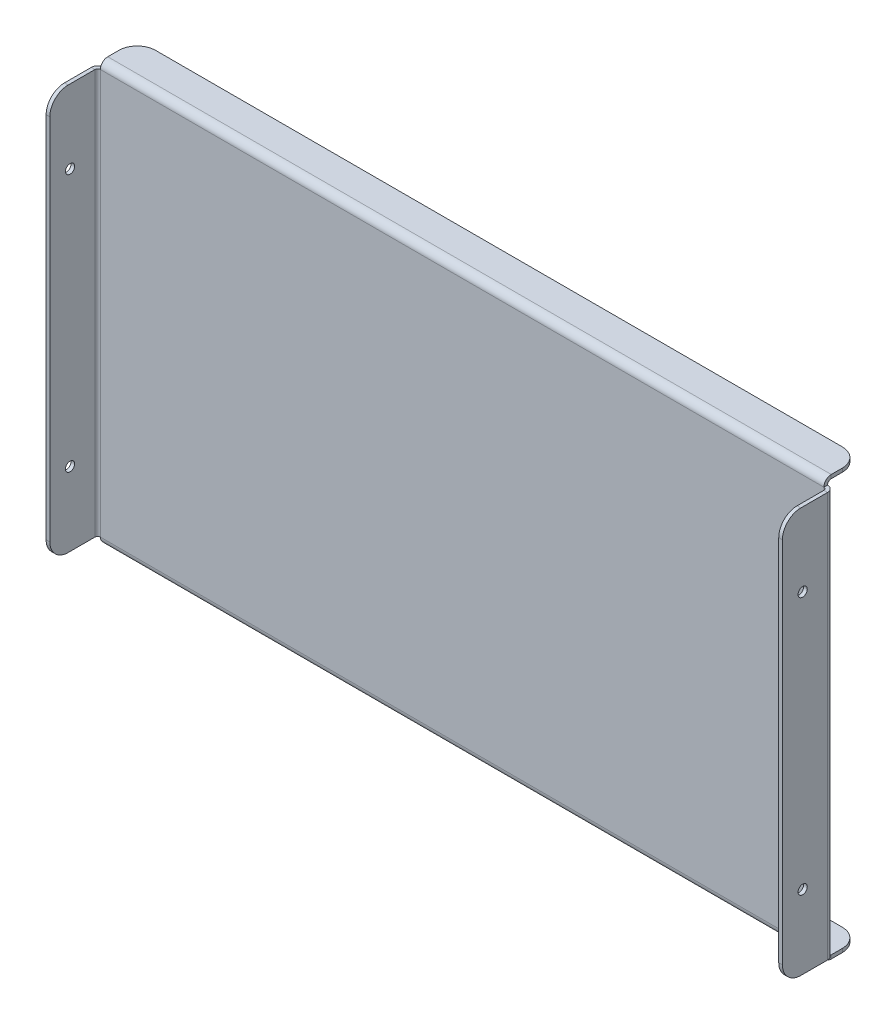
from build123d import *

# Parameters (mm, degrees)
SKETCH1_W                    = 200
SKETCH1_H                    = 110
BASE_FLANGE1_DEPTH           = 1
EDGE_FLANGE1_STRIP_W         = 5.4732
EDGE_FLANGE1_STRIP_H         = 1
EDGE_FLANGE1_STRIP_CUT_DEPTH = 110
EDGE_FLANGE1_DEPTH           = 110
EDGE_FLANGE2_STRIP_W         = 5.4732
EDGE_FLANGE2_STRIP_H         = 1
EDGE_FLANGE2_STRIP_CUT_DEPTH = 110
EDGE_FLANGE2_DEPTH           = 110
CUT_EXTRUDE1_DEPTH           = 207.869524097
CUT_EXTRUDE1_DEPTH_BACK      = 10
SKETCH14_R                   = 1.25
EDGE_FLANGE3_DEPTH           = 196.5268
EDGE_FLANGE3_BEND_DEPTH      = 196.5268
FILLET1_R                    = 5


# Sheet-metal steps are written as plain solids
with BuildPart() as part:
    # Sketch1 → Base-Flange1 (new body)
    with BuildSketch(Plane.XY):
        Rectangle(SKETCH1_W, SKETCH1_H)
    extrude(amount=-BASE_FLANGE1_DEPTH)

    # Edge-Flange1 strip (across the edge) → Edge-Flange1 strip cut (cut)
    with BuildSketch(Plane(origin=(-100, 55, 0), x_dir=(1, 0, 0), z_dir=(0, -1, 0))):
        with Locations((-1, -0.5)):
            Rectangle(EDGE_FLANGE1_STRIP_W, EDGE_FLANGE1_STRIP_H)
    extrude(amount=EDGE_FLANGE1_STRIP_CUT_DEPTH, mode=Mode.SUBTRACT)

    # Edge-Flange1 section (across the edge) → Edge-Flange1 (add)
    with BuildSketch(Plane(origin=(-100, 55, 0), x_dir=(1, 0, 0), z_dir=(0, -1, 0))):
        with BuildLine():
            Line((0, 0.7366), (0, 13))
            Line((0, 13), (1, 13))
            Line((1, 13), (1, 0.7366))
            ThreePointArc((1, 0.7366), (1.215745145, 0.215745145), (1.7366, 0))
            Line((1.7366, 0), (1.7366, -1))
            ThreePointArc((1.7366, -1), (0.508638364, -0.491361636), (0, 0.7366))
        make_face()
    extrude(amount=EDGE_FLANGE1_DEPTH)

    # Edge-Flange2 strip (across the edge) → Edge-Flange2 strip cut (cut)
    with BuildSketch(Plane(origin=(100, -55, 0), x_dir=(-1, 0, 0), z_dir=(0, 1, 0))):
        with Locations((-1, -0.5)):
            Rectangle(EDGE_FLANGE2_STRIP_W, EDGE_FLANGE2_STRIP_H)
    extrude(amount=EDGE_FLANGE2_STRIP_CUT_DEPTH, mode=Mode.SUBTRACT)

    # Edge-Flange2 section (across the edge) → Edge-Flange2 (add)
    with BuildSketch(Plane(origin=(100, -55, 0), x_dir=(-1, 0, 0), z_dir=(0, 1, 0))):
        with BuildLine():
            Line((0, 0.7366), (0, 13))
            Line((0, 13), (1, 13))
            Line((1, 13), (1, 0.7366))
            ThreePointArc((1, 0.7366), (1.215745145, 0.215745145), (1.7366, 0))
            Line((1.7366, 0), (1.7366, -1))
            ThreePointArc((1.7366, -1), (0.508638364, -0.491361636), (0, 0.7366))
        make_face()
    extrude(amount=EDGE_FLANGE2_DEPTH)

    # Sketch14 → Cut-Extrude1 (cut, two sides: drawn at the far end of the back side and taken through both)
    with BuildSketch(Plane(origin=(-99, 0, 0), x_dir=(0, 0, -1), z_dir=(1, 0, 0)).offset(-CUT_EXTRUDE1_DEPTH_BACK)):
        with Locations(Location((-7.5, -35, 0), (0, 0, 180))):
            Circle(SKETCH14_R)
        with Locations(Location((-7.5, 35, 0), (0, 0, 180))):
            Circle(SKETCH14_R)
    extrude(amount=CUT_EXTRUDE1_DEPTH + CUT_EXTRUDE1_DEPTH_BACK, mode=Mode.SUBTRACT)

    # Edge-Flange3 section (across the edge) → Edge-Flange3 (add)
    with BuildSketch(Plane(origin=(98.2634, -56, -1), x_dir=(0, 1, 0), z_dir=(-1, 0, 0))):
        with BuildLine():
            Line((-1, 1), (-1, 9))
            Line((-1, 9), (0, 9))
            Line((0, 9), (0, 1))
            ThreePointArc((0, 1), (0.292893219, 0.292893219), (1, 0))
            Line((1, 0), (1, -1))
            ThreePointArc((1, -1), (-0.414213562, -0.414213562), (-1, 1))
        make_face()
    extrude(amount=EDGE_FLANGE3_DEPTH)

    # Edge-Flange3 section 2 (across the edge) → Edge-Flange3 bend (add)
    with BuildSketch(Plane(origin=(-98.2634, 56, -1), x_dir=(0, -1, 0), z_dir=(1, 0, 0))):
        with BuildLine():
            Line((-1, 1), (-1, 9))
            Line((-1, 9), (0, 9))
            Line((0, 9), (0, 1))
            ThreePointArc((0, 1), (0.292893219, 0.292893219), (1, 0))
            Line((1, 0), (1, -1))
            ThreePointArc((1, -1), (-0.414213562, -0.414213562), (-1, 1))
        make_face()
    extrude(amount=EDGE_FLANGE3_BEND_DEPTH)

    # Fillet1
    fillet1_edges = [part.edges().sort_by_distance(p)[0] for p in [
        (98.2634, -56.5, -10),
        (-98.2634, -56.5, -10),
        (-98.2634, 56.5, -10),
        (98.2634, 56.5, -10),
        (-99.5, 55, 13),
        (-99.5, -55, 13),
        (99.5, -55, 13),
        (99.5, 55, 13),
    ]]
    fillet(fillet1_edges, radius=FILLET1_R)


solid = part.part
